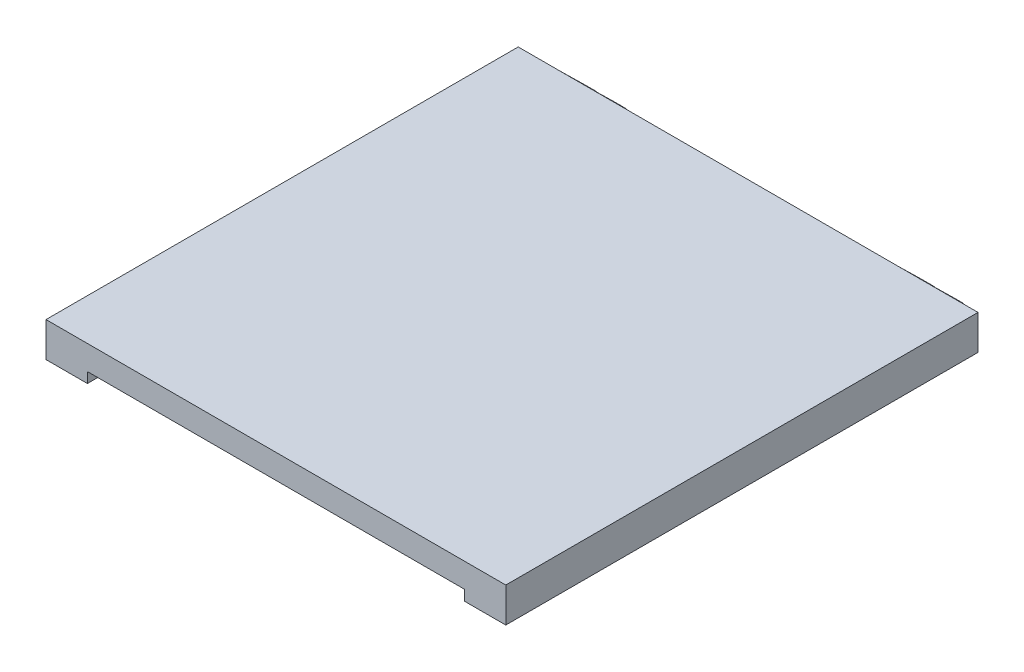
from build123d import *

# Parameters (mm, degrees)
SKETCH1_W               = 140.97
SKETCH1_H               = 144.78
BOSS_EXTRUDE1_DEPTH     = 5.08
SKETCH2_W               = 140.97
SKETCH2_H               = 144.78
SKETCH2_W_2             = 115.57
SKETCH2_H_2             = 12.7
SKETCH2_W_3             = 130.81
SKETCH2_H_3             = 120.65
BOSS_EXTRUDE2_DEPTH     = 5.55625
SKETCH3_W               = 115.57
SKETCH3_H               = 19.05
CUT_EXTRUDE1_DEPTH      = 3.175
SKETCH4_R               = 2.2
BOSS_EXTRUDE3_DEPTH     = 3
MIRROR2_COPY_1_SKETCH_R = 2.2
MIRROR2_COPY_1_DEPTH    = 3


with BuildPart() as part:
    # Sketch1 → Boss-Extrude1 (new body)
    with BuildSketch(Plane(origin=(0, 0, 0), x_dir=(1, 0, 0), z_dir=(0, 1, 0))):
        Rectangle(SKETCH1_W, SKETCH1_H)
    extrude(amount=BOSS_EXTRUDE1_DEPTH)

    # Sketch2 → Boss-Extrude2 (add)
    with BuildSketch(Plane.XZ):
        Rectangle(SKETCH2_W, SKETCH2_H)
        with Locations((0, 62.865)):
            Rectangle(SKETCH2_W_2, SKETCH2_H_2, mode=Mode.SUBTRACT)
        with Locations((0, -6.985)):
            Rectangle(SKETCH2_W_3, SKETCH2_H_3, mode=Mode.SUBTRACT)
    extrude(amount=BOSS_EXTRUDE2_DEPTH)

    # Sketch3 → Cut-Extrude1 (cut)
    with BuildSketch(Plane.XZ.offset(5.55625)):
        with Locations((0, 62.865)):
            Rectangle(SKETCH3_W, SKETCH3_H)
    extrude(amount=-CUT_EXTRUDE1_DEPTH, mode=Mode.SUBTRACT)

    # Sketch4 → Boss-Extrude3 (add)
    with BuildSketch(Plane(origin=(57.785, 0, 0), x_dir=(0, 0, -1), z_dir=(1, 0, 0))):
        with BuildLine():
            Line((72.39, 5.08), (80.298586194, -2.669654518))
            ThreePointArc((80.298586194, -2.669654518), (80.144596616, -8.586079413), (74.254776903, -8.004856495))
            Line((74.254776903, -8.004856495), (72.39, -5.55625))
            Line((72.39, -5.55625), (72.39, 5.08))
        make_face()
        with Locations((77.47, -5.55625)):
            Circle(SKETCH4_R, mode=Mode.SUBTRACT)
    boss_extrude3 = extrude(amount=-BOSS_EXTRUDE3_DEPTH)

    # Mirror1: Boss-Extrude3 across plane
    add(boss_extrude3.mirror(Plane.ZY.offset(-51.784999904)))

    # Mirror2: Boss-Extrude3 across plane
    add(boss_extrude3.mirror(Plane(origin=(0, 0, 0), x_dir=(0, 0, 1), z_dir=(1, 0, 0))))

    # Mirror2 copy 1 sketch → Mirror2 copy 1 (add)
    with BuildSketch(Plane(origin=(-45.784999808, 0, 0), x_dir=(0, 0, -1), z_dir=(1, 0, 0))):
        with BuildLine():
            Line((72.39, 5.08), (80.298586194, -2.669654518))
            ThreePointArc((80.298586194, -2.669654518), (80.144596616, -8.586079413), (74.254776903, -8.004856495))
            Line((74.254776903, -8.004856495), (72.39, -5.55625))
            Line((72.39, -5.55625), (72.39, 5.08))
        make_face()
        with Locations((77.47, -5.55625)):
            Circle(MIRROR2_COPY_1_SKETCH_R, mode=Mode.SUBTRACT)
    extrude(amount=-MIRROR2_COPY_1_DEPTH)


solid = part.part
